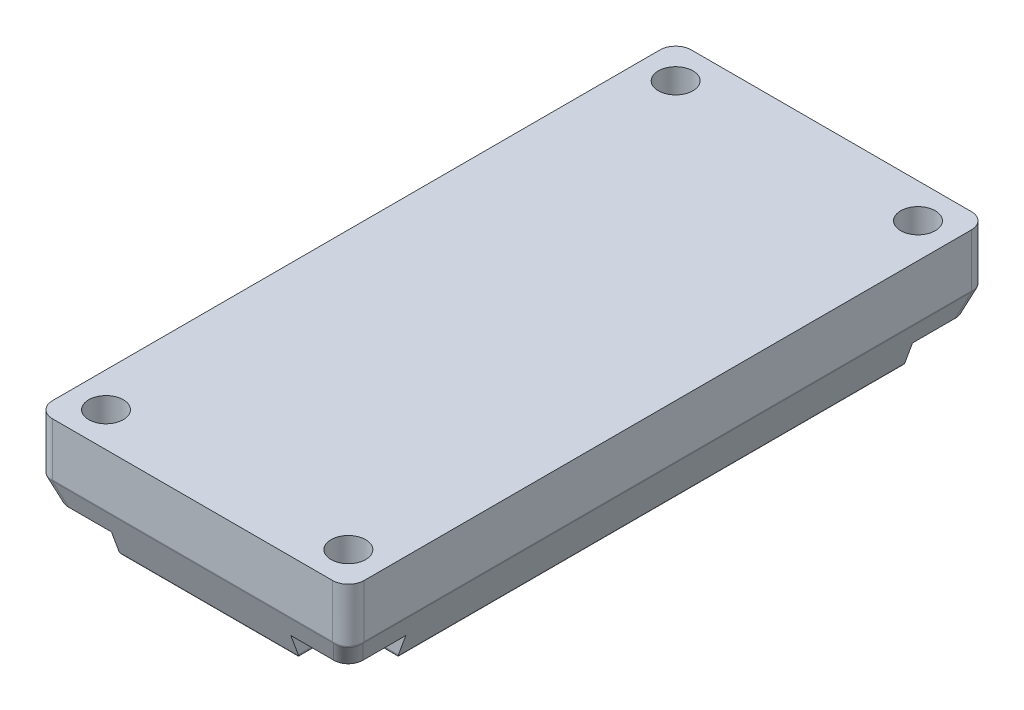
from build123d import *

# Parameters (mm, degrees)
SKETCH1_W            = 19.8
SKETCH1_H            = 40.6
BOSS_EXTRUDE1_DEPTH  = 6.4
CUT_EXTRUDE1_DEPTH   = 1.5
M2_CLEARANCE_HOLE1_D = 2.2
MIRROR2_COPY_1_DEPTH = 1.5
MIRROR2_COPY_2_D     = 2.2
CUT_EXTRUDE2_DEPTH   = 24.474667197
CUT_EXTRUDE3_DEPTH   = 24.474667197
FILLET1_R            = 1
FILLET2_R            = 0.2


with BuildPart() as part:
    # Sketch1 → Boss-Extrude1 (new body)
    with BuildSketch(Plane(origin=(0, 0, 0), x_dir=(1, 0, 0), z_dir=(0, 1, 0))):
        Rectangle(SKETCH1_W, SKETCH1_H)
    extrude(amount=-BOSS_EXTRUDE1_DEPTH)

    # Sketch2 → Cut-Extrude1 (cut)
    with BuildSketch(Plane(origin=(0, -6.4, 0), x_dir=(-1, 0, 0), z_dir=(0, -1, 0))):
        with BuildLine():
            Line((5.7, -17.9), (5.7, -20.3))
            Line((5.7, -20.3), (9.9, -20.3))
            Line((9.9, -20.3), (9.9, -16.1))
            Line((9.9, -16.1), (7.5, -16.1))
            ThreePointArc((7.5, -16.1), (6.227207794, -16.627207794), (5.7, -17.9))
        make_face()
    cut_extrude1 = extrude(amount=-CUT_EXTRUDE1_DEPTH, mode=Mode.SUBTRACT)

    # M2 Clearance Hole1 (through all)
    with Locations(Plane(origin=(0, -4.9, 0), x_dir=(-1, 0, 0), z_dir=(0, -1, 0))):
        with Locations((7.7, -18.1)):
            m2_clearance_hole1 = Hole(M2_CLEARANCE_HOLE1_D / 2)

    # Mirror1: Cut-Extrude1, M2 Clearance Hole1 across plane
    add(cut_extrude1.mirror(Plane(origin=(0, 0, 0), x_dir=(0, 0, 1), z_dir=(1, 0, 0))), mode=Mode.SUBTRACT)
    add(m2_clearance_hole1.mirror(Plane(origin=(0, 0, 0), x_dir=(0, 0, 1), z_dir=(1, 0, 0))), mode=Mode.SUBTRACT)

    # Mirror2: Cut-Extrude1, M2 Clearance Hole1 across plane
    add(cut_extrude1.mirror(Plane.XY), mode=Mode.SUBTRACT)
    add(m2_clearance_hole1.mirror(Plane.XY), mode=Mode.SUBTRACT)

    # Mirror2 copy 1 sketch → Mirror2 copy 1 (cut)
    with BuildSketch(Plane.XZ.offset(6.4)):
        with BuildLine():
            Line((5.7, -17.9), (5.7, -20.3))
            Line((5.7, -20.3), (9.9, -20.3))
            Line((9.9, -20.3), (9.9, -16.1))
            Line((9.9, -16.1), (7.5, -16.1))
            ThreePointArc((7.5, -16.1), (6.227207794, -16.627207794), (5.7, -17.9))
        make_face()
    extrude(amount=-MIRROR2_COPY_1_DEPTH, mode=Mode.SUBTRACT)

    # Mirror2 copy 2 (through all)
    with Locations(Plane.XZ.offset(4.9)):
        with Locations((7.7, -18.1)):
            Hole(MIRROR2_COPY_2_D / 2)

    # Sketch3 → Cut-Extrude2 (cut, symmetric)
    with BuildSketch(Plane.XY):
        Polygon((9.9, -3.4), (9.9, -6.4), (8.808089297, -6.4), align=None)
    cut_extrude2 = extrude(amount=CUT_EXTRUDE2_DEPTH, both=True, mode=Mode.SUBTRACT)

    # Mirror3: Cut-Extrude2 across plane
    add(cut_extrude2.mirror(Plane(origin=(0, 0, 0), x_dir=(0, 0, 1), z_dir=(1, 0, 0))), mode=Mode.SUBTRACT)

    # Sketch4 → Cut-Extrude3 (cut, symmetric)
    with BuildSketch(Plane(origin=(0, 0, 0), x_dir=(0, 0, -1), z_dir=(1, 0, 0))):
        Polygon((20.3, -3.4), (19.208089297, -6.4), (20.3, -6.4), align=None)
    cut_extrude3 = extrude(amount=CUT_EXTRUDE3_DEPTH, both=True, mode=Mode.SUBTRACT)

    # Mirror4: Cut-Extrude3 across plane
    add(cut_extrude3.mirror(Plane.XY), mode=Mode.SUBTRACT)

    # Fillet1
    # the kernel refuses this fillet: 1 mm, written as the material it takes off along each edge
    with BuildSketch(Plane(origin=(9.9, 2.5, 20.3), x_dir=(0, 0, -1), z_dir=(0, -1, 0)), Plane(origin=(9.9, 2.5, -20.3), x_dir=(-1, 0, 0), z_dir=(0, -1, 0))) as fillet1_piece_1:
        with BuildLine():
            CenterArc((FILLET1_R, -FILLET1_R), FILLET1_R, 90, 90)
            Line((0, -FILLET1_R), (0, 0))
            Line((0, 0), (FILLET1_R, 0))
        make_face()
    extrude(amount=8.4, mode=Mode.SUBTRACT)
    with BuildSketch(Plane(origin=(-9.9, 2.5, 20.3), x_dir=(0, 0, -1), z_dir=(0, -1, 0)), Plane(origin=(-9.9, 2.5, -20.3), x_dir=(1, 0, 0), z_dir=(0, -1, 0))) as fillet1_piece_2:
        with BuildLine():
            CenterArc((FILLET1_R, FILLET1_R), FILLET1_R, 180, 90)
            Line((0, FILLET1_R), (0, 0))
            Line((0, 0), (FILLET1_R, 0))
        make_face()
    extrude(amount=8.4, mode=Mode.SUBTRACT)
    with BuildSketch(Plane(origin=(-10.619337956, -1.423635209, -21.019337956), x_dir=(0.9461886483394667, 0.3040991697893275, -0.11068304606837777), z_dir=(0.3236155771181803, -0.8891264907159921, 0.3236155771181788)), Plane(origin=(-10.619337956, -1.423635209, 21.019337956), x_dir=(-0.1106830460683747, 0.30409916978932705, -0.9461886483394673), z_dir=(0.3236155771181803, -0.8891264907159921, -0.3236155771181788))) as fillet1_piece_3:
        with BuildLine():
            CenterArc((FILLET1_R * 0.889126490716, FILLET1_R), FILLET1_R, 186.717713464, 83.282286536)
            Line((-FILLET1_R * 0.104008041637, FILLET1_R * 0.883022221559), (0, 0))
            Line((0, 0), (FILLET1_R * 0.889126490716, 0))
        make_face()
    extrude(amount=6.132681502, mode=Mode.SUBTRACT)
    with BuildSketch(Plane(origin=(10.619337956, -1.423635209, -21.019337956), x_dir=(-0.9461886483394667, 0.3040991697893275, -0.11068304606837777), z_dir=(-0.3236155771181803, -0.8891264907159921, 0.3236155771181788)), Plane(origin=(10.619337956, -1.423635209, 21.019337956), x_dir=(0.1106830460683747, 0.30409916978932705, -0.9461886483394673), z_dir=(-0.3236155771181803, -0.8891264907159921, -0.3236155771181788))) as fillet1_piece_4:
        with BuildLine():
            CenterArc((FILLET1_R * 0.889126490716, -FILLET1_R), FILLET1_R, 90, 83.282286536)
            Line((-FILLET1_R * 0.104008041637, -FILLET1_R * 0.883022221559), (0, 0))
            Line((0, 0), (FILLET1_R * 0.889126490716, 0))
        make_face()
    extrude(amount=6.132681502, mode=Mode.SUBTRACT)

    # Fillet2
    fillet2_edges = [part.edges().sort_by_distance(p)[0] for p in [
        (8.154044649, -6.4, 16.1),
        (8.808089297, -6.4, 0),
        (-8.154044649, -6.4, -16.1),
        (-8.154044649, -6.4, 16.1),
        (-8.808089297, -6.4, 0),
        (0, -6.4, -19.208089297),
        (0, -6.4, 19.208089297),
        (0, -3.4, -20.3),
        (8.929401523, -3.401187785, -20.299567682),
        (-8.929401523, -3.401187785, -20.299567682),
        (-9.9, -3.4, 0),
        (-9.899567682, -3.401187785, 19.329401523),
        (-9.899567682, -3.401187785, -19.329401523),
        (-6.227207794, -6.4, 16.627207794),
        (-5.7, -6.4, 18.554044649),
        (9.9, -3.4, 0),
        (9.899567682, -3.401187785, 19.329401523),
        (9.899567682, -3.401187785, -19.329401523),
        (0, -3.4, 20.3),
        (-8.929401523, -3.401187785, 20.299567682),
        (8.929401523, -3.401187785, 20.299567682),
        (-9.607106781, -3.465933948, -20.007106781),
        (9.607106781, -3.465933948, -20.007106781),
        (9.607106781, -3.465933948, 20.007106781),
        (-9.607106781, -3.465933948, 20.007106781),
        (6.227207794, -6.4, 16.627207794),
        (5.7, -6.4, 18.554044649),
        (-6.227207794, -6.4, -16.627207794),
        (-5.7, -6.4, -18.554044649),
        (6.227207794, -6.4, -16.627207794),
        (5.7, -6.4, -18.554044649),
        (8.154044649, -6.4, -16.1),
    ]]
    fillet(fillet2_edges, radius=FILLET2_R)


solid = part.part
